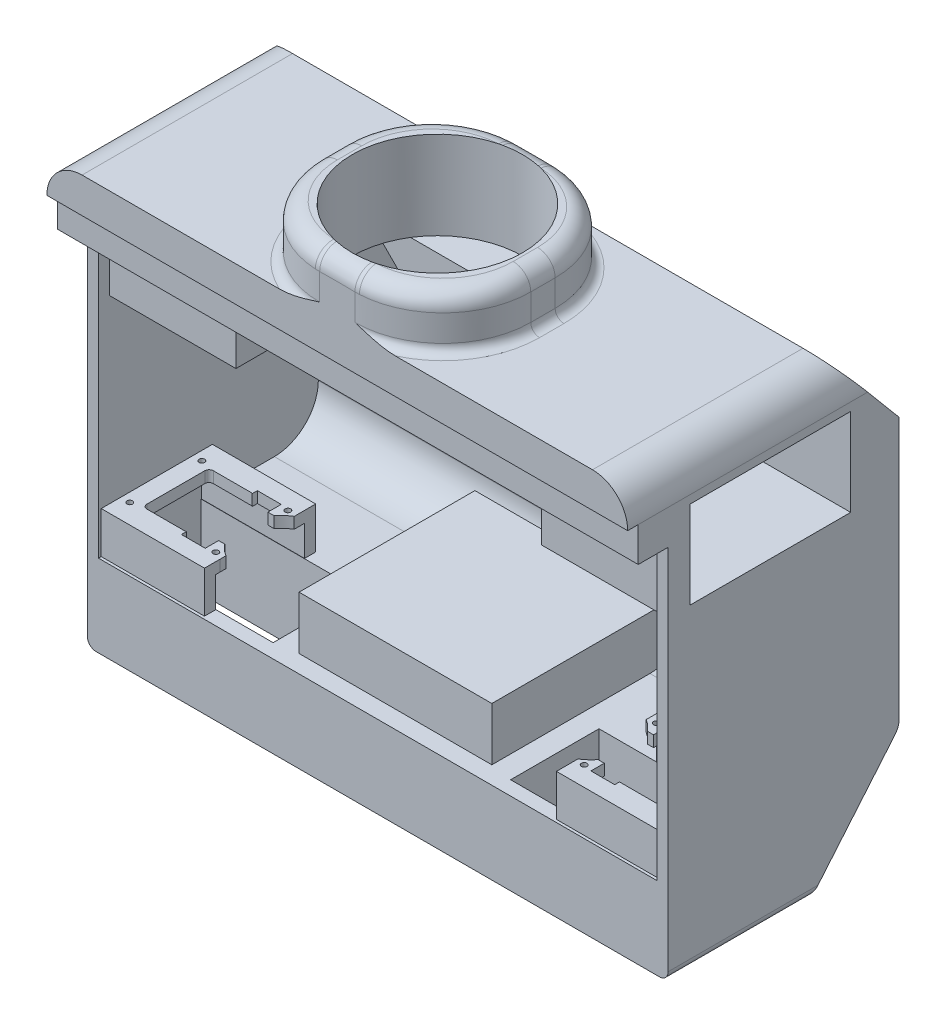
from build123d import *

# Parameters (mm, degrees)
SKETCH1_W               = 165.1
SKETCH1_H               = 54
BOSS_EXTRUDE1_DEPTH     = 6.35
BOSS_EXTRUDE2_DEPTH     = 165.1
SKETCH7_W               = 3.175
SKETCH7_H               = 90
BOSS_EXTRUDE3_DEPTH     = 62.482691454
BOSS_EXTRUDE4_DEPTH     = 1
CUT_EXTRUDE2_DEPTH      = 193.510277918
CUT_EXTRUDE2_DEPTH_BACK = 193.510277918
SKETCH10_W              = 60
SKETCH10_H              = 47.65
BOSS_EXTRUDE6_DEPTH     = 3.175
SKETCH15_W              = 45.62
SKETCH15_H              = 25.12
CUT_EXTRUDE3_DEPTH      = 10
SKETCH16_W              = 165.1
SKETCH16_H              = 65.657691454
SKETCH16_W_2            = 45.62
SKETCH16_H_2            = 25.12
BOSS_EXTRUDE7_DEPTH     = 17
CHAMFER2_SIZE           = 4
CHAMFER2_SIZE2          = 3.356398525
CHAMFER3_SIZE           = 30
CHAMFER3_SIZE2          = 25.172988935
FILLET1_R               = 12.5
FILLET2_R               = 5
CHAMFER5_SIZE           = 3.175
CHAMFER6_SIZE           = 3.175
BOSS_EXTRUDE9_DEPTH     = 20.535
BOSS_EXTRUDE10_REACH    = 145.635
CUT_EXTRUDE4_DEPTH      = 20
SKETCH25_R              = 24.2
SKETCH25_R_2            = 4.327955779
BOSS_EXTRUDE11_DEPTH    = 10
CHAMFER9_SIZE2          = 8.390996312
CHAMFER9_SIZE           = 10
SKETCH26_W              = 60
SKETCH26_H              = 56.936490272
SKETCH26_R              = 24.2
BOSS_EXTRUDE12_DEPTH    = 15
BOSS_EXTRUDE13_DEPTH    = 3.5
FILLET6_R               = 25
FILLET7_R               = 5
SKETCH28_W              = 35.968101279
SKETCH28_H              = 45.615895688
CUT_EXTRUDE5_DEPTH      = 7.5
SKETCH29_W              = 35.968101279
SKETCH29_H              = 45.615895688
CUT_EXTRUDE6_DEPTH      = 7.5
FILLET8_R               = 10
FILLET9_R               = 2.5
SKETCH31_W              = 5.585601369
SKETCH31_H              = 21.2
CUT_EXTRUDE7_DEPTH      = 10
SKETCH30_R              = 0.8
BOSS_EXTRUDE14_DEPTH    = 7.08
SKETCH33_W              = 12
SKETCH33_H              = 51.965895688
CUT_EXTRUDE9_DEPTH      = 7.5
CHAMFER12_SIZE          = 7.5
BOSS_EXTRUDE15_DEPTH    = 3.175
SKETCH37_W              = 32.793101279
SKETCH37_H              = 45.615895688
BOSS_EXTRUDE16_DEPTH    = 3.175
SKETCH42_R              = 0.8
CUT_EXTRUDE10_DEPTH     = 8
BOSS_EXTRUDE17_DEPTH    = 3.175
SKETCH41_W              = 29.34851345
SKETCH41_H              = 3.175
SKETCH41_W_2            = 29.348515031
BOSS_EXTRUDE19_DEPTH    = 8.65
SKETCH43_W              = 54.81
SKETCH43_H              = 44.952691454
SKETCH43_H_2            = 5.047308546
BOSS_EXTRUDE20_DEPTH    = 15.1
FILLET11_R              = 2.5


# Some blends are built 0.0001 mm under size
with BuildPart() as part:
    # Sketch1 → Boss-Extrude1 (new body)
    with BuildSketch(Plane(origin=(0, 0, 0), x_dir=(1, 0, 0), z_dir=(0, 1, 0))):
        with Locations((0, 1.6)):
            Rectangle(SKETCH1_W, SKETCH1_H)
    extrude(amount=BOSS_EXTRUDE1_DEPTH)

    # Sketch6 → Boss-Extrude2 (add)
    with BuildSketch(Plane.ZY.offset(82.55)):
        Polygon((-37.082691454, 90), (-37.082691454, 6.35), (-28.6, 6.35), (-28.6, 0), (-40.257691454, 0), (-40.257691454, 90), align=None)
    extrude(amount=-BOSS_EXTRUDE2_DEPTH)

    # Sketch7 → Boss-Extrude3 (add)
    with BuildSketch(Plane.XY.offset(25.4)):
        with Locations((-80.9625, 45)):
            Rectangle(SKETCH7_W, SKETCH7_H)
        with Locations((80.9625, 45)):
            Rectangle(SKETCH7_W, SKETCH7_H)
    extrude(amount=-BOSS_EXTRUDE3_DEPTH)

    # Sketch9 → Boss-Extrude4 (add)
    with BuildSketch(Plane(origin=(0, 0, -40.257691454), x_dir=(-1, 0, 0), z_dir=(0, 0, -1))):
        with BuildLine():
            Line((-65.55, 83), (65.55, 83))
            ThreePointArc((65.55, 83), (66.964213562, 82.414213562), (67.55, 81))
            Line((67.55, 81), (67.55, 32))
            ThreePointArc((67.55, 32), (66.964213562, 30.585786438), (65.55, 30))
            Line((65.55, 30), (-65.55, 30))
            ThreePointArc((-65.55, 30), (-66.964213562, 30.585786438), (-67.55, 32))
            Line((-67.55, 32), (-67.55, 81))
            ThreePointArc((-67.55, 81), (-66.964213562, 82.414213562), (-65.55, 83))
        make_face()
    extrude(amount=BOSS_EXTRUDE4_DEPTH)

    # Sketch10 → Cut-Extrude2 (cut, two sides: drawn at the far end of the back side and taken through both)
    with BuildSketch(Plane.ZY.offset(82.55).offset(-CUT_EXTRUDE2_DEPTH_BACK)):
        with Locations((-4.6, 66.175)):
            Rectangle(SKETCH10_W, SKETCH10_H)
    extrude(amount=CUT_EXTRUDE2_DEPTH + CUT_EXTRUDE2_DEPTH_BACK, mode=Mode.SUBTRACT)

    # Sketch12 → Boss-Extrude6 (add)
    with BuildSketch(Plane(origin=(0, 90, 0), x_dir=(1, 0, 0), z_dir=(0, 1, 0))):
        Polygon((-82.55, -25.4), (-82.55, -30.4), (82.55, -30.4), (82.55, -25.4), (82.55, 40.257691454), (-82.55, 40.257691454), align=None)
    extrude(amount=BOSS_EXTRUDE6_DEPTH)

    # Sketch15 → Cut-Extrude3 (cut)
    with BuildSketch(Plane.XZ):
        with Locations((-56.565, 8.821154273)):
            Rectangle(SKETCH15_W, SKETCH15_H)
        with Locations((56.565, 8.821154273)):
            Rectangle(SKETCH15_W, SKETCH15_H)
    extrude(amount=-CUT_EXTRUDE3_DEPTH, mode=Mode.SUBTRACT)

    # Sketch16 → Boss-Extrude7 (add)
    with BuildSketch(Plane.XZ):
        with Locations((0, -7.428845727)):
            Rectangle(SKETCH16_W, SKETCH16_H)
        with Locations((-56.565, 8.821154273)):
            Rectangle(SKETCH16_W_2, SKETCH16_H_2, mode=Mode.SUBTRACT)
        with Locations((56.565, 8.821154273)):
            Rectangle(SKETCH16_W_2, SKETCH16_H_2, mode=Mode.SUBTRACT)
    extrude(amount=BOSS_EXTRUDE7_DEPTH)

    # Chamfer2
    chamfer2_edges = [part.edges().sort_by_distance(p)[0] for p in [
        (0, 93.175, -40.257691454),
    ]]
    chamfer2_side = [part.faces().sort_by_distance(p)[0] for p in [
        (0, 26.143741279, -40.257691454),
    ]]
    chamfer(chamfer2_edges, length=CHAMFER2_SIZE, length2=CHAMFER2_SIZE2, reference=chamfer2_side[0])

    # Chamfer3
    chamfer3_edges = [part.edges().sort_by_distance(p)[0] for p in [
        (0, -17, -40.257691454),
    ]]
    chamfer3_side = [part.faces().sort_by_distance(p)[0] for p in [
        (0, 22.003358437, -40.257691454),
    ]]
    chamfer(chamfer3_edges, length=CHAMFER3_SIZE, length2=CHAMFER3_SIZE2, reference=chamfer3_side[0])

    # Fillet1
    fillet1_edges = [part.edges().sort_by_distance(p)[0] for p in [
        (0, 6.35, -37.082691454),
    ]]
    fillet(fillet1_edges, radius=FILLET1_R)

    # Fillet2
    fillet2_edges = [part.edges().sort_by_distance(p)[0] for p in [
        (0, 13, -40.257691454),
    ]]
    fillet(fillet2_edges, radius=FILLET2_R)

    # Chamfer5
    chamfer5_edges = [part.edges().sort_by_distance(p)[0] for p in [
        (-80.9625, 90, -34.6),
        (80.9625, 90, -34.6),
    ]]
    chamfer(chamfer5_edges, length=CHAMFER5_SIZE)

    # Chamfer6
    chamfer6_edges = [part.edges().sort_by_distance(p)[0] for p in [
        (-80.9625, 42.35, -34.6),
        (80.9625, 42.35, -34.6),
    ]]
    chamfer(chamfer6_edges, length=CHAMFER6_SIZE)

    # Sketch18 → Boss-Extrude9 (add)
    with BuildSketch(Plane(origin=(0, 93.175, 0), x_dir=(1, 0, 0), z_dir=(0, 1, 0))):
        Polygon((-46.581898721, -19.129674968), (-82.55, -19.129674968), (-82.55, -22.304674968), (-43.406898721, -22.304674968), (-43.406898721, 29.66122072), (-82.55, 29.66122072), (-82.55, 26.48622072), (-46.581898721, 26.48622072), align=None)
    boss_extrude9 = extrude(amount=-BOSS_EXTRUDE9_DEPTH)

    # Mirror1: Boss-Extrude9 across plane
    add(boss_extrude9.mirror(Plane(origin=(0, 0, 0), x_dir=(0, 0, 1), z_dir=(1, 0, 0))))

    # Boss-Extrude10: up to this plane
    boss_extrude10_end = Plane(origin=(0, 93.175, -36.901292929), z_dir=(0, 0.642787609686539, -0.7660444431189783))
    # Sketch20 → Boss-Extrude10 (add, up to the surface)
    with BuildSketch(Plane.XY.offset(30.4), mode=Mode.PRIVATE) as boss_extrude10_sk1:
        Polygon((-52.55, 99.825839879), (52.55, 99.825839879), (82.55, 99.825839879), (82.55, 93.175), (-82.55, 93.175), (-82.55, 99.825839879), align=None)
    boss_extrude10_tool1 = split(extrude(boss_extrude10_sk1.sketch, amount=-BOSS_EXTRUDE10_REACH, mode=Mode.PRIVATE), bisect_by=boss_extrude10_end, keep=Keep.BOTH, mode=Mode.PRIVATE)
    add(boss_extrude10_tool1.solids().sort_by_distance((0, 96.50042, 30.4))[0])

    # Sketch23 → Cut-Extrude4 (cut)
    with BuildSketch(Plane(origin=(0, 99.825839879, 0), x_dir=(1, 0, 0), z_dir=(0, 1, 0))):
        with BuildLine():
            Line((8.384417448, -20.561333056), (9.877394556, -19.068355948))
            ThreePointArc((9.877394556, -19.068355948), (10.188277859, -18.689544742), (10.419285151, -18.257361923))
            ThreePointArc((10.419285151, -18.257361923), (10.561538197, -17.788414636), (10.609570503, -17.300725817))
            Line((10.609570503, -17.300725817), (10.609570503, 0.433707386))
            ThreePointArc((10.609570503, 0.433707386), (10.561538223, 0.921395053), (10.419285642, 1.39034128))
            ThreePointArc((10.419285642, 1.39034128), (10.188277932, 1.822525176), (9.877393834, 2.201337214))
            Line((9.877393834, 2.201337214), (8.384416723, 3.694314325))
            ThreePointArc((8.384416723, 3.694314325), (8.005605517, 4.005197628), (7.573422697, 4.23620492))
            ThreePointArc((7.573422697, 4.23620492), (7.104475411, 4.378457966), (6.616786591, 4.426490271))
            Line((6.616786591, 4.426490271), (-33.110604264, 4.426490271))
            ThreePointArc((-33.110604264, 4.426490271), (-34.87827006, 3.694345107), (-35.610429497, 1.926685224))
            Line((-35.610429497, 1.926685224), (-35.610429497, -18.793692999))
            ThreePointArc((-35.610429497, -18.793692999), (-35.420160735, -19.750343242), (-34.878277155, -20.561357469))
            ThreePointArc((-34.878277155, -20.561357469), (-34.067268353, -21.103238753), (-33.110624449, -21.293509728))
            Line((-33.110624449, -21.293509728), (6.616786596, -21.293509728))
            ThreePointArc((6.616786596, -21.293509728), (7.104474783, -21.245477548), (7.573421511, -21.103224868))
            ThreePointArc((7.573421511, -21.103224868), (8.005605409, -20.872217156), (8.384417448, -20.561333056))
        make_face()
    extrude(amount=-CUT_EXTRUDE4_DEPTH, mode=Mode.SUBTRACT)

    # Sketch25 → Boss-Extrude11 (add)
    # profile 1 of 2: a face of its own
    with BuildSketch(Plane(origin=(0, 99.825839879, 0), x_dir=(1, 0, 0), z_dir=(0, 1, 0))):
        Polygon((-82.55, -30.4), (-82.55, 31.320575639), (82.55, 31.320575639), (82.55, -30.4), (82.55, -36.9), (-82.55, -36.9), align=None)
        with Locations(Location((-0.000429497, -8.433509728, 0), (0, 0, 147.89956854))):
            Circle(SKETCH25_R, mode=Mode.SUBTRACT)
    # profile 2 of 2: a face of its own
    with BuildSketch(Plane(origin=(0, 99.825839879, 0), x_dir=(1, 0, 0), z_dir=(0, 1, 0))):
        with Locations((-0.000429497, -8.433509728)):
            Circle(SKETCH25_R_2)
    extrude(amount=BOSS_EXTRUDE11_DEPTH)


with BuildPart() as boss_extrude11_kept_piece:
    # of the separate pieces the step leaves, the one the design keeps (boss_extrude11_pieces_kept)
    add(part.part.solids().sort_by_distance((-82.55, 45.525, -34.6))[0])

    # Chamfer9
    chamfer9_edges = [boss_extrude11_kept_piece.edges().sort_by_distance(p)[0] for p in [
        (0, 109.825839879, -31.320575639),
    ]]
    chamfer9_side = [boss_extrude11_kept_piece.faces().sort_by_distance(p)[0] for p in [
        (0, 109.658019953, -31.320575639),
    ]]
    chamfer(chamfer9_edges, length=CHAMFER9_SIZE - 0.0001, length2=CHAMFER9_SIZE2 - 0.0001, reference=chamfer9_side[0])  # a hair under: the kernel refuses the full size

    # Sketch26 → Boss-Extrude12 (add)
    with BuildSketch(Plane(origin=(0, 109.825839879, 0), x_dir=(1, 0, 0), z_dir=(0, 1, 0))):
        with Locations((-0.000429497, -8.431754864)):
            Rectangle(SKETCH26_W, SKETCH26_H)
        with Locations(Location((-0.000429497, -8.433509728, 0), (0, 0, 147.89956854))):
            Circle(SKETCH26_R, mode=Mode.SUBTRACT)
    extrude(amount=BOSS_EXTRUDE12_DEPTH)

    # Sketch27 → Boss-Extrude13 (add)
    with BuildSketch(Plane.XY.offset(30.4)):
        Polygon((82.55, 90), (82.55, 99.825839879), (10.154042678, 99.825839879), (-10.154901672, 99.825839879), (-82.55, 99.825839879), (-82.55, 90), align=None)
    extrude(amount=BOSS_EXTRUDE13_DEPTH)

    # Fillet6
    fillet6_edges = [boss_extrude11_kept_piece.edges().sort_by_distance(p)[0] for p in [
        (-30.000429497, 117.325839879, 36.9),
        (29.999570503, 117.325839879, 36.9),
        (29.999570503, 117.325839879, -20.036490272),
        (-30.000429497, 117.325839879, -20.036490272),
    ]]
    fillet(fillet6_edges, radius=FILLET6_R)

    # Fillet7
    fillet7_edges = [boss_extrude11_kept_piece.edges().sort_by_distance(p)[0] for p in [
        (22.677240033, 124.825839879, -12.714159801),
        (29.999570503, 124.825839879, 8.431754864),
        (22.677240033, 124.825839879, 29.57766953),
        (-22.678099027, 124.825839879, 29.57766953),
        (-30.000429497, 124.825839879, 8.431754864),
        (-22.678099027, 124.825839879, -12.714159801),
    ]]
    fillet(fillet7_edges, radius=FILLET7_R)

    # Sketch28 → Cut-Extrude5 (cut)
    with BuildSketch(Plane.XZ.offset(-90)):
        with Locations((64.565949361, -3.678272876)):
            Rectangle(SKETCH28_W, SKETCH28_H)
    extrude(amount=-CUT_EXTRUDE5_DEPTH, mode=Mode.SUBTRACT)

    # Sketch29 → Cut-Extrude6 (cut)
    with BuildSketch(Plane.XZ.offset(-90)):
        with Locations((-64.565949361, -3.678272876)):
            Rectangle(SKETCH29_W, SKETCH29_H)
    extrude(amount=-CUT_EXTRUDE6_DEPTH, mode=Mode.SUBTRACT)

    # Fillet8
    fillet8_edges = [boss_extrude11_kept_piece.edges().sort_by_distance(p)[0] for p in [
        (82.55, 109.825839879, 6.985160336),
        (-82.55, 109.825839879, 6.985160336),
    ]]
    fillet(fillet8_edges, radius=FILLET8_R - 0.0001)  # a hair under: the kernel refuses the full size

    # Fillet9
    fillet9_edges = [boss_extrude11_kept_piece.edges().sort_by_distance(p)[0] for p in [
        (-82.55, -17, 5.157648741),
        (82.55, -17, 5.157648741),
    ]]
    fillet(fillet9_edges, radius=FILLET9_R)

    # Sketch31 → Cut-Extrude7 (cut)
    with BuildSketch(Plane(origin=(-43.406898721, 0, 0), x_dir=(0, 0, -1), z_dir=(1, 0, 0))):
        with Locations((5.166969313, 85.04)):
            Rectangle(SKETCH31_W, SKETCH31_H)
    cut_extrude7 = extrude(amount=-CUT_EXTRUDE7_DEPTH, mode=Mode.SUBTRACT)

    # Sketch30 → Boss-Extrude14 (add)
    with BuildSketch(Plane(origin=(-43.406898721, 0, 0), x_dir=(0, 0, -1), z_dir=(1, 0, 0))):
        Polygon((-3.358535112, 96.400005376), (-3.358535112, 95.107314564), (2.374168628, 91.540005378), (2.374168628, 95.64), (7.959769997, 95.64), (8.504985928, 94.564765777), (21.838059268, 94.564765777), (21.838059268, 75.489463978), (8.504985928, 75.489463978), (7.959769997, 74.44), (2.374168628, 74.44), (2.374168628, 78.540005378), (-3.358530552, 74.972690815), (-3.358530552, 73.679999994), (-2.358530552, 72.679998788), (24.290180845, 72.679972485), (26.290012732, 74.679801961), (26.286225253, 95.206411236), (24.180057422, 97.400004065), (-2.358535217, 97.400004065), align=None)
        with Locations((-0.520014072, 95.29)):
            Circle(SKETCH30_R, mode=Mode.SUBTRACT)
        with Locations((23.929985928, 95.29)):
            Circle(SKETCH30_R, mode=Mode.SUBTRACT)
        with Locations((23.929985928, 74.79)):
            Circle(SKETCH30_R, mode=Mode.SUBTRACT)
        with Locations((-0.520014072, 74.79)):
            Circle(SKETCH30_R, mode=Mode.SUBTRACT)
    boss_extrude14 = extrude(amount=-BOSS_EXTRUDE14_DEPTH)

    # Sketch33 → Cut-Extrude9 (cut)
    with BuildSketch(Plane.XZ.offset(-90)):
        with Locations((-37.406898721, -3.678272876)):
            Rectangle(SKETCH33_W, SKETCH33_H)
        with Locations((37.406898721, -3.678272876)):
            Rectangle(SKETCH33_W, SKETCH33_H)
    extrude(amount=-CUT_EXTRUDE9_DEPTH, mode=Mode.SUBTRACT)

    # Chamfer12
    chamfer12_edges = [boss_extrude11_kept_piece.edges().sort_by_distance(p)[0] for p in [
        (-31.406898721, 90, 21.799092348),
        (-31.406898721, 90, -17.043855495),
        (31.406898721, 90, -3.678272876),
    ]]
    chamfer(chamfer12_edges, length=CHAMFER12_SIZE - 0.0001)  # a hair under: the kernel refuses the full size

    # Mirror2: Cut-Extrude7, Boss-Extrude14 across plane
    add(cut_extrude7.mirror(Plane(origin=(0, 0, 0), x_dir=(0, 0, 1), z_dir=(1, 0, 0))), mode=Mode.SUBTRACT)
    add(boss_extrude14.mirror(Plane(origin=(0, 0, 0), x_dir=(0, 0, 1), z_dir=(1, 0, 0))))

    # Sketch36 → Boss-Extrude15 (add)
    with BuildSketch(Plane.ZY.offset(82.55)):
        Polygon((-29.66122072, 72.64), (-29.66122072, 90), (-31.425, 90), (-34.6, 86.825), (-34.6, 45.525), (-31.425, 42.35), (25.4, 42.35), (25.4, 90), (22.304674968, 90), (22.304674968, 72.64), align=None)
    boss_extrude15 = extrude(amount=-BOSS_EXTRUDE15_DEPTH)

    # Sketch37 → Boss-Extrude16 (add)
    with BuildSketch(Plane.XZ.offset(-72.64)):
        with Locations((-62.978449361, -3.678272876)):
            Rectangle(SKETCH37_W, SKETCH37_H)
        Polygon((-43.406898721, -29.66122072), (-43.406898721, 22.304674968), (-79.375, 22.304674968), (-79.375, 19.129674968), (-46.581898721, 19.129674968), (-46.581898721, -26.48622072), (-79.375, -26.48622072), (-79.375, -29.66122072), align=None)
    boss_extrude16 = extrude(amount=BOSS_EXTRUDE16_DEPTH)

    # Sketch42 → Cut-Extrude10 (cut)
    with BuildSketch(Plane.ZY.offset(50.486898721)):
        with Locations(Location((-23.929985928, 74.79, 0), (0, 0, 180))):
            Circle(SKETCH42_R)
        with Locations(Location((0.520014072, 74.79, 0), (0, 0, 180))):
            Circle(SKETCH42_R)
        with Locations(Location((0.520014072, 95.29, 0), (0, 0, 180))):
            Circle(SKETCH42_R)
        with Locations(Location((-23.929985928, 95.29, 0), (0, 0, 180))):
            Circle(SKETCH42_R)
    cut_extrude10 = extrude(amount=-CUT_EXTRUDE10_DEPTH, mode=Mode.SUBTRACT)

    # Mirror3: Boss-Extrude15, Boss-Extrude16, Cut-Extrude10 across plane
    add(boss_extrude15.mirror(Plane(origin=(0, 0, 0), x_dir=(0, 0, 1), z_dir=(1, 0, 0))))
    add(boss_extrude16.mirror(Plane(origin=(0, 0, 0), x_dir=(0, 0, 1), z_dir=(1, 0, 0))))
    add(cut_extrude10.mirror(Plane(origin=(0, 0, 0), x_dir=(0, 0, 1), z_dir=(1, 0, 0))), mode=Mode.SUBTRACT)

    # Sketch39 → Boss-Extrude17 (add)
    with BuildSketch(Plane(origin=(0, 15, 0), x_dir=(1, 0, 0), z_dir=(0, 1, 0))):
        with BuildLine():
            Line((-50.026484969, 2.538834251), (-50.026484969, 6.985329662))
            Line((-50.026484969, 6.985329662), (-82.55, 6.985329662))
            Line((-82.55, 6.985329662), (-82.55, 3.038878455))
            Line((-82.55, 3.038878455), (-82.55, -20.681183224))
            Line((-82.55, -20.681183224), (-82.55, -24.62763407))
            Line((-82.55, -24.62763407), (-50.02648655, -24.62763407))
            Line((-50.02648655, -24.62763407), (-50.02648655, -20.181146472))
            Line((-50.02648655, -20.181146472), (-50.026483181, -18.52763407))
            ThreePointArc((-50.026483181, -18.52763407), (-51.660455267, -17.310211409), (-53.051383222, -15.821150585))
            Line((-53.051383222, -15.821150585), (-54.814999932, -15.82115373))
            Line((-54.814999932, -15.82115373), (-54.815000004, -19.621154273))
            Line((-54.815000004, -19.621154273), (-61.59, -19.621154273))
            Line((-61.59, -19.621154273), (-61.59, -18.124197186))
            Line((-61.59, -18.124197186), (-61.812898808, -18.263440967))
            Line((-61.812898808, -18.263440967), (-72.768085322, -18.263440967))
            ThreePointArc((-72.768085322, -18.263440967), (-73.616613459, -17.911969105), (-73.968085322, -17.063440969))
            Line((-73.968085322, -17.063440969), (-73.968085322, -0.578867579))
            ThreePointArc((-73.968085322, -0.578867579), (-73.616613461, 0.269660557), (-72.768085326, 0.621132421))
            Line((-72.768085326, 0.621132421), (-61.812898808, 0.621132421))
            Line((-61.812898808, 0.621132421), (-61.59, 0.48188864))
            Line((-61.59, 0.48188864), (-61.59, 1.978845727))
            Line((-61.59, 1.978845727), (-54.815000004, 1.978845727))
            Line((-54.815000004, 1.978845727), (-54.814999932, -1.821154814))
            Line((-54.814999932, -1.821154814), (-53.051385765, -1.821157945))
            ThreePointArc((-53.051385765, -1.821157945), (-51.660455467, -0.33209461), (-50.026480298, 0.885329662))
            Line((-50.026480298, 0.885329662), (-50.026484969, 2.538834251))
        make_face()
        with BuildLine():
            ThreePointArc((-53.165, -19.071154273), (-52.365023362, -19.87113429), (-51.565039966, -19.071161031))
            ThreePointArc((-51.565039966, -19.071161031), (-52.365016604, -18.271174256), (-53.165, -19.071154273))
        make_face(mode=Mode.SUBTRACT)
        with BuildLine():
            ThreePointArc((-51.565039964, 1.42883958), (-52.365016909, 2.228825745), (-53.165, 1.428845727))
            ThreePointArc((-53.165, 1.428845727), (-52.365023056, 0.628865709), (-51.565039964, 1.42883958))
        make_face(mode=Mode.SUBTRACT)
        with BuildLine():
            ThreePointArc((-76.015039964, -19.07116042), (-76.815016909, -18.271174255), (-77.615, -19.071154273))
            ThreePointArc((-77.615, -19.071154273), (-76.815023056, -19.871134291), (-76.015039964, -19.07116042))
        make_face(mode=Mode.SUBTRACT)
        with BuildLine():
            ThreePointArc((-76.015039964, 1.42883958), (-76.815016909, 2.228825745), (-77.615, 1.428845727))
            ThreePointArc((-77.615, 1.428845727), (-76.815023056, 0.628865709), (-76.015039964, 1.42883958))
        make_face(mode=Mode.SUBTRACT)
    boss_extrude17 = extrude(amount=BOSS_EXTRUDE17_DEPTH)

    # Sketch41 → Boss-Extrude19 (add)
    with BuildSketch(Plane.XZ.offset(-15)):
        with Locations((-64.700743275, 23.04013407)):
            Rectangle(SKETCH41_W, SKETCH41_H)
        with Locations((-64.700742484, -5.397829662)):
            Rectangle(SKETCH41_W_2, SKETCH41_H)
    boss_extrude19 = extrude(amount=BOSS_EXTRUDE19_DEPTH)

    # Mirror4: Boss-Extrude17, Boss-Extrude19 across plane
    add(boss_extrude17.mirror(Plane(origin=(0, 0, 0), x_dir=(0, 0, 1), z_dir=(1, 0, 0))))
    add(boss_extrude19.mirror(Plane(origin=(0, 0, 0), x_dir=(0, 0, 1), z_dir=(1, 0, 0))))

    # Sketch43 → Boss-Extrude20 (add)
    with BuildSketch(Plane(origin=(0, 6.35, 0), x_dir=(1, 0, 0), z_dir=(0, 1, 0))):
        with Locations((0, 2.106345727)):
            Rectangle(SKETCH43_W, SKETCH43_H)
        with Locations((0, 27.106345727)):
            Rectangle(SKETCH43_W, SKETCH43_H_2)
    extrude(amount=BOSS_EXTRUDE20_DEPTH)

    # Fillet11
    # the kernel refuses this fillet: 2.5 mm, written as the material it adds along each edge
    with BuildSketch(Plane(origin=(-30.000429497, 109.825839879, 11.9), x_dir=(-1, 0, 0), z_dir=(0, 0, -1)), Plane(origin=(29.999570503, 109.825839879, 4.963509728), x_dir=(1, 0, 0), z_dir=(0, 0, 1))) as fillet11_piece_1:
        with BuildLine():
            CenterArc((FILLET11_R, FILLET11_R), FILLET11_R, 180, 90)
            Line((0, FILLET11_R), (0, 0))
            Line((0, 0), (FILLET11_R, 0))
        make_face()
    extrude(amount=6.936490272)
    with BuildSketch(Plane(origin=(-5.000429497, 109.825839879, -20.036490272), x_dir=(0, 0, -1), z_dir=(1, 0, 0))) as fillet11_piece_2:
        with BuildLine():
            CenterArc((FILLET11_R, FILLET11_R), FILLET11_R, 180, 90)
            Line((0, FILLET11_R), (0, 0))
            Line((0, 0), (FILLET11_R, 0))
        make_face()
    extrude(amount=10)
    with BuildSketch(Plane(origin=(-5.000429497, 109.825839879, 4.963509728), x_dir=(0, 0, -1), z_dir=(1, 0, 0))) as fillet11_piece_3:
        with BuildLine():
            CenterArc((25 + FILLET11_R, FILLET11_R), FILLET11_R, 180, 90)
            Line((25, FILLET11_R), (25, 0))
            Line((25, 0), (25 + FILLET11_R, 0))
        make_face()
    revolve(axis=Axis((-5.000429497, 109.825839879, 4.963509728), (0, 1, 0)), revolution_arc=90)
    with BuildSketch(Plane(origin=(4.999570503, 109.825839879, 4.963509728), x_dir=(1, 0, 0), z_dir=(0, 0, 1))) as fillet11_piece_4:
        with BuildLine():
            CenterArc((25 + FILLET11_R, FILLET11_R), FILLET11_R, 180, 90)
            Line((25, FILLET11_R), (25, 0))
            Line((25, 0), (25 + FILLET11_R, 0))
        make_face()
    revolve(axis=Axis((4.999570503, 109.825839879, 4.963509728), (0, 1, 0)), revolution_arc=90)
    with BuildSketch(Plane(origin=(-5.000429497, 109.825839879, 11.9), x_dir=(-1, 0, 0), z_dir=(0, 0, -1))) as fillet11_piece_5_section:
        with BuildLine():
            CenterArc((25 + FILLET11_R, FILLET11_R), FILLET11_R, 180, 90)
            Line((25, FILLET11_R), (25, 0))
            Line((25, 0), (25 + FILLET11_R, 0))
        make_face()
    fillet11_piece_5 = revolve(axis=Axis((-5.000429497, 109.825839879, 11.9), (0, 1, 0)), revolution_arc=104.329698924, mode=Mode.PRIVATE)
    fillet11_piece_5 = split(fillet11_piece_5, bisect_by=Plane(origin=(-30.5204431, 110.241688985, 36.9), z_dir=(0, 0, -1)), keep=Keep.TOP, mode=Mode.PRIVATE)
    add(fillet11_piece_5)
    with BuildSketch(Plane(origin=(4.999570503, 109.825839879, 11.9), x_dir=(1, 0, 0), z_dir=(0, 0, -1))) as fillet11_piece_6_section:
        with BuildLine():
            CenterArc((25 + FILLET11_R, -FILLET11_R), FILLET11_R, 90, 90)
            Line((25, -FILLET11_R), (25, 0))
            Line((25, 0), (25 + FILLET11_R, 0))
        make_face()
    fillet11_piece_6 = revolve(axis=Axis((4.999570503, 109.825839879, 11.9), (0, -1, 0)), revolution_arc=104.329698924, mode=Mode.PRIVATE)
    fillet11_piece_6 = split(fillet11_piece_6, bisect_by=Plane(origin=(30.519612639, 110.24154741, 36.9), z_dir=(0, 0, -1)), keep=Keep.TOP, mode=Mode.PRIVATE)
    add(fillet11_piece_6)


solid = boss_extrude11_kept_piece.part
